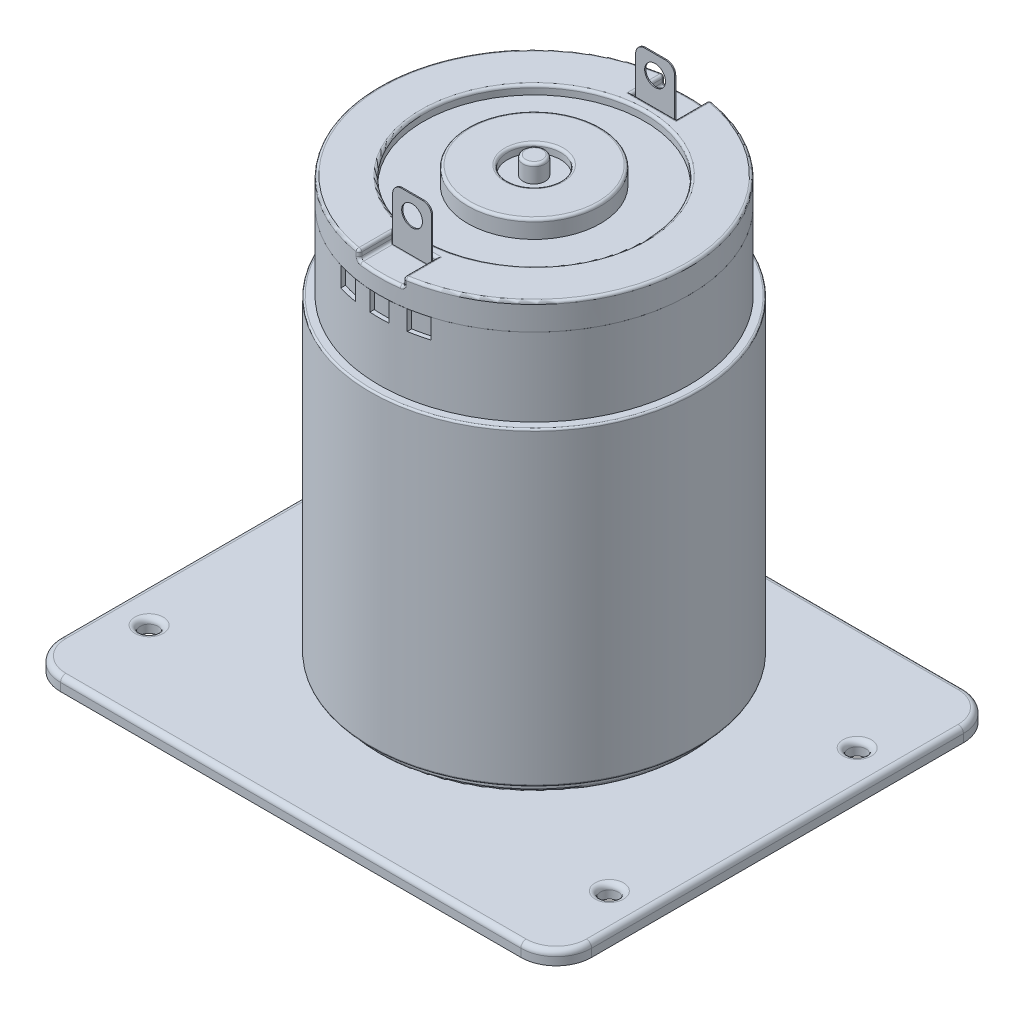
from build123d import *

# Parameters (mm, degrees)
BOSS_EXTRUDE1_DEPTH      = 1.5
SKETCH2_R                = 1
CUT_EXTRUDE1_DEPTH       = 40.080046059
FILLET1_R                = 0.6
SKETCH3_R                = 10
BOSS_EXTRUDE2_DEPTH      = 0.3
SKETCH4_R                = 17.5
BOSS_EXTRUDE3_DEPTH      = 10
FILLET2_R                = 0.3
SURFACE_EXTRUDE1_1_DEPTH = 35
THICKEN1_T1              = 0.5
CUT_EXTRUDE2_DEPTH       = 61.952768641
CUT_EXTRUDE2_DEPTH_BACK  = 61.952768641
SKETCH6_W                = 2.183834742
SKETCH6_H                = 2.225752743
SKETCH7_R                = 17
BOSS_EXTRUDE4_DEPTH      = 35
THICKEN2_START           = 3
THICKEN2_DEPTH           = 35
SKETCH9_R                = 17.5
BOSS_EXTRUDE5_DEPTH      = 3
SKETCH10_R               = 12.5
CUT_EXTRUDE3_DEPTH       = 1
SKETCH11_R               = 7.5
BOSS_EXTRUDE6_DEPTH      = 2
SKETCH12_R               = 3
CUT_EXTRUDE4_DEPTH       = 1
SKETCH13_R               = 1.25
BOSS_EXTRUDE7_DEPTH      = 2
SKETCH14_W               = 5
SKETCH14_H               = 11.684380043
CUT_EXTRUDE5_DEPTH       = 1
SKETCH15_W               = 4.4
SKETCH15_H               = 0.125302321
BOSS_EXTRUDE8_DEPTH      = 6
FILLET3_R                = 1
SKETCH16_R               = 1.175126505
CUT_EXTRUDE6_DEPTH       = 6
SKETCH18_W               = 4.4
SKETCH18_H               = 0.125302321
BOSS_EXTRUDE10_DEPTH     = 6
FILLET4_R                = 1
SKETCH19_R               = 1.175126505
CUT_EXTRUDE7_DEPTH       = 6
FILLET5_R                = 0.3
FILLET6_R                = 0.3
FILLET7_R                = 0.2
FILLET8_R                = 0.2
FILLET9_R                = 0.2


# Read off the part's stored shape, not the designer's step: Thicken2
with BuildPart() as part:
    # Sketch1 → Boss-Extrude1 (new body)
    with BuildSketch(Plane(origin=(0, 0, 0), x_dir=(1, 0, 0), z_dir=(0, 1, 0))):
        with BuildLine():
            Line((-26, -25), (26, -25))
            ThreePointArc((26, -25), (28.828427125, -23.828427125), (30, -21))
            Line((30, -21), (30, 21))
            ThreePointArc((30, 21), (28.828427125, 23.828427125), (26, 25))
            Line((26, 25), (-26, 25))
            ThreePointArc((-26, 25), (-28.828427125, 23.828427125), (-30, 21))
            Line((-30, 21), (-30, -21))
            ThreePointArc((-30, -21), (-28.828427125, -23.828427125), (-26, -25))
        make_face()
    extrude(amount=BOSS_EXTRUDE1_DEPTH)

    # Sketch2 → Cut-Extrude1 (cut, through all)
    with BuildSketch(Plane(origin=(0, 1.5, 0), x_dir=(1, 0, 0), z_dir=(0, 1, 0))):
        with Locations(Location((-26, 13, 0), (0, 0, 270))):
            Circle(SKETCH2_R)
        with Locations(Location((-26, -15, 0), (0, 0, 270))):
            Circle(SKETCH2_R)
        with Locations(Location((26, 13, 0), (0, 0, 90))):
            Circle(SKETCH2_R)
        with Locations(Location((26, -15, 0), (0, 0, 90))):
            Circle(SKETCH2_R)
    extrude(amount=-CUT_EXTRUDE1_DEPTH, mode=Mode.SUBTRACT)

    # Fillet1
    fillet1_edges = [part.edges().sort_by_distance(p)[0] for p in [
        (-28.828427125, 1.5, -23.828427125),
        (0, 1.5, -25),
        (28.828427125, 1.5, -23.828427125),
        (30, 1.5, 0),
        (28.828427125, 1.5, 23.828427125),
        (-26, 1.5, -14),
        (0, 1.5, 25),
        (-26, 1.5, 14),
        (26, 1.5, -12),
        (26, 1.5, 16),
        (-28.828427125, 1.5, 23.828427125),
        (-30, 1.5, 0),
    ]]
    fillet(fillet1_edges, radius=FILLET1_R)

    # Sketch3 → Boss-Extrude2 (add)
    with BuildSketch(Plane(origin=(0, 1.5, 0), x_dir=(1, 0, 0), z_dir=(0, 1, 0))):
        with Locations(Location((0, 2.5, 0), (0, 0, 90))):
            Circle(SKETCH3_R)
    extrude(amount=BOSS_EXTRUDE2_DEPTH)

    # Sketch4 → Boss-Extrude3 (add)
    with BuildSketch(Plane(origin=(0, 1.8, 0), x_dir=(1, 0, 0), z_dir=(0, 1, 0))):
        with Locations(Location((0, 2.5, 0), (0, 0, 270))):
            Circle(SKETCH4_R)
    extrude(amount=BOSS_EXTRUDE3_DEPTH)

    # Fillet2
    fillet2_edges = [part.edges().sort_by_distance(p)[0] for p in [
        (0, 1.8, -20),
    ]]
    fillet(fillet2_edges, radius=FILLET2_R)

    # Surface-Extrude1: a surface, the sketch's curves swept straight by 35 mm
    with BuildLine(Plane(origin=(0, 11.8, 0), x_dir=(1, 0, 0), z_dir=(0, 1, 0)), mode=Mode.PRIVATE) as surface_extrude1_1_path:
        CenterArc((0, 2.5), 17.5, 0, 360)
    surface_extrude1_1 = Shell.extrude(surface_extrude1_1_path.wire(), (0 * SURFACE_EXTRUDE1_1_DEPTH, 1 * SURFACE_EXTRUDE1_1_DEPTH, 0 * SURFACE_EXTRUDE1_1_DEPTH))
    add(Solid.thicken(surface_extrude1_1, THICKEN1_T1))

    # Sketch6 → Cut-Extrude2 (cut, two sides: drawn at the far end of the back side and taken through both)
    with BuildSketch(Plane.XY.offset(-CUT_EXTRUDE2_DEPTH_BACK)):
        with Locations((4, 45.687123629)):
            Rectangle(SKETCH6_W, SKETCH6_H)
        with Locations((0, 45.687123629)):
            Rectangle(SKETCH6_W, SKETCH6_H)
        with Locations((-4, 45.687123629)):
            Rectangle(SKETCH6_W, SKETCH6_H)
    extrude(amount=CUT_EXTRUDE2_DEPTH + CUT_EXTRUDE2_DEPTH_BACK, mode=Mode.SUBTRACT)


with BuildPart() as body_2:
    # Sketch7 → Boss-Extrude4 (new body)
    with BuildSketch(Plane(origin=(0, 11.8, 0), x_dir=(1, 0, 0), z_dir=(0, 1, 0))):
        with Locations(Location((0, 2.5, 0), (0, 0, 90))):
            Circle(SKETCH7_R)
    extrude(amount=BOSS_EXTRUDE4_DEPTH)


with BuildPart() as body_3:
    # Thicken2 outline → Thicken2 (new body)
    with BuildSketch(Plane(origin=(0, 0, 0), x_dir=(1, 0, 0), z_dir=(0, 1, 0)).offset(THICKEN2_START)):
        with BuildLine():
            ThreePointArc((-18.429061875, 0.881457943), (18.499789791, 2.411808873), (-18.412792979, 4.294172436))
            Line((-18.412792979, 4.294172436), (-17.417506872, 4.197190142))
            ThreePointArc((-17.417506872, 4.197190142), (17.499801154, 2.416575952), (-17.432896369, 0.968946703))
            Line((-17.432896369, 0.968946703), (-18.429061875, 0.881457943))
        make_face()
    extrude(amount=THICKEN2_DEPTH)

    # Fillet7
    fillet7_edges = [body_3.edges().sort_by_distance(p)[0] for p in [
        (18.499789791, 38, -2.411808873),
    ]]
    fillet(fillet7_edges, radius=FILLET7_R)

    # Fillet8
    fillet8_edges = [body_3.edges().sort_by_distance(p)[0] for p in [
        (18.499789791, 3, -2.411808873),
    ]]
    fillet(fillet8_edges, radius=FILLET8_R)

    # Fillet9
    fillet9_edges = [body_3.edges().sort_by_distance(p)[0] for p in [
        (-17.831362571, 38, -0.933951199),
        (-17.815621315, 38, -4.23598306),
        (-17.815621315, 3, -4.23598306),
        (-17.831362571, 3, -0.933951199),
        (-18.412792979, 20.5, -4.294172436),
        (-18.429061875, 20.5, -0.881457943),
    ]]
    fillet(fillet9_edges, radius=FILLET9_R)


with BuildPart() as body_4:
    # Sketch9 → Boss-Extrude5 (new body)
    with BuildSketch(Plane(origin=(0, 46.8, 0), x_dir=(1, 0, 0), z_dir=(0, 1, 0))):
        with Locations(Location((0, 2.5, 0), (0, 0, 270))):
            Circle(SKETCH9_R)
    extrude(amount=BOSS_EXTRUDE5_DEPTH)

    # Sketch10 → Cut-Extrude3 (cut)
    with BuildSketch(Plane(origin=(0, 49.8, 0), x_dir=(1, 0, 0), z_dir=(0, 1, 0))):
        with Locations(Location((0, 2.5, 0), (0, 0, 270))):
            Circle(SKETCH10_R)
    extrude(amount=-CUT_EXTRUDE3_DEPTH, mode=Mode.SUBTRACT)

    # Sketch11 → Boss-Extrude6 (add)
    with BuildSketch(Plane(origin=(0, 48.8, 0), x_dir=(1, 0, 0), z_dir=(0, 1, 0))):
        with Locations(Location((0, 2.5, 0), (0, 0, 270))):
            Circle(SKETCH11_R)
    extrude(amount=BOSS_EXTRUDE6_DEPTH)

    # Sketch12 → Cut-Extrude4 (cut)
    with BuildSketch(Plane(origin=(0, 50.8, 0), x_dir=(1, 0, 0), z_dir=(0, 1, 0))):
        with Locations(Location((0, 2.5, 0), (0, 0, 270))):
            Circle(SKETCH12_R)
    extrude(amount=-CUT_EXTRUDE4_DEPTH, mode=Mode.SUBTRACT)

    # Sketch14 → Cut-Extrude5 (cut)
    with BuildSketch(Plane(origin=(0, 49.8, 0), x_dir=(1, 0, 0), z_dir=(0, 1, 0))):
        with Locations((0, 21.899071736)):
            Rectangle(SKETCH14_W, SKETCH14_H)
        with Locations((0, -16.899071736)):
            Rectangle(SKETCH14_W, SKETCH14_H)
    extrude(amount=-CUT_EXTRUDE5_DEPTH, mode=Mode.SUBTRACT)

    # Fillet5
    fillet5_edges = [body_4.edges().sort_by_distance(p)[0] for p in [
        (0, 50.8, -10),
        (0, 50.8, -5.5),
        (-17.5, 49.8, -2.5),
        (-2.5, 49.8, -17.938694895),
        (0, 48.8, -20),
        (2.5, 49.8, -17.938694895),
        (0, 49.8, -16.056881714),
        (2.5, 48.8, -17.938694895),
        (2.5, 49.3, -19.820508076),
        (-2.5, 49.3, -19.820508076),
        (-2.5, 48.8, -17.938694895),
        (0, 48.8, -16.056881714),
        (17.5, 49.8, -2.5),
        (2.5, 49.8, 12.938694895),
        (-1.253217594, 48.8, 14.95506934),
        (0, 49.8, 11.056881714),
        (-2.5, 49.8, 12.938694895),
        (-2.5, 48.8, 12.938694895),
        (-2.5, 49.3, 14.820508076),
        (2.5, 49.3, 14.820508076),
        (2.5, 48.8, 12.938694895),
        (0, 48.8, 11.056881714),
        (0, 49.8, -15),
    ]]
    fillet(fillet5_edges, radius=FILLET5_R)


with BuildPart() as body_5:
    # Sketch13 → Boss-Extrude7 (new body)
    with BuildSketch(Plane(origin=(0, 49.8, 0), x_dir=(1, 0, 0), z_dir=(0, 1, 0))):
        with Locations(Location((0, 2.5, 0), (0, 0, 270))):
            Circle(SKETCH13_R)
    extrude(amount=BOSS_EXTRUDE7_DEPTH)

    # Fillet6
    fillet6_edges = [body_5.edges().sort_by_distance(p)[0] for p in [
        (0, 51.8, -3.75),
    ]]
    fillet(fillet6_edges, radius=FILLET6_R)


with BuildPart() as body_6:
    # Sketch15 → Boss-Extrude8 (new body)
    with BuildSketch(Plane(origin=(0, 48.8, 0), x_dir=(1, 0, 0), z_dir=(0, 1, 0))):
        with Locations((0.010105862, -11.227127299)):
            Rectangle(SKETCH15_W, SKETCH15_H)
    extrude(amount=BOSS_EXTRUDE8_DEPTH)

    # Fillet3
    fillet3_edges = [body_6.edges().sort_by_distance(p)[0] for p in [
        (-2.189894138, 54.8, 11.227127298),
        (2.210105862, 54.8, 11.227127298),
    ]]
    fillet(fillet3_edges, radius=FILLET3_R)

    # Sketch16 → Cut-Extrude6 (cut)
    with BuildSketch(Plane.XY.offset(11.289778459)):
        with Locations((0, 52.707439071)):
            Circle(SKETCH16_R)
    extrude(amount=-CUT_EXTRUDE6_DEPTH, mode=Mode.SUBTRACT)


with BuildPart() as body_7:
    # Sketch18 → Boss-Extrude10 (new body)
    with BuildSketch(Plane(origin=(0, 48.8, 0), x_dir=(1, 0, 0), z_dir=(0, 1, 0))):
        with Locations((0.010105862, 16.227127299)):
            Rectangle(SKETCH18_W, SKETCH18_H)
    extrude(amount=BOSS_EXTRUDE10_DEPTH)

    # Fillet4
    fillet4_edges = [body_7.edges().sort_by_distance(p)[0] for p in [
        (2.210105862, 54.8, -16.227127298),
        (-2.189894138, 54.8, -16.227127298),
    ]]
    fillet(fillet4_edges, radius=FILLET4_R)

    # Sketch19 → Cut-Extrude7 (cut)
    with BuildSketch(Plane(origin=(0, 0, -16.289778459), x_dir=(-1, 0, 0), z_dir=(0, 0, -1))):
        with Locations((0, 52.707439071)):
            Circle(SKETCH19_R)
    extrude(amount=-CUT_EXTRUDE7_DEPTH, mode=Mode.SUBTRACT)


solid = Compound([part.part, body_2.part, body_3.part, body_4.part, body_5.part, body_6.part, body_7.part])
